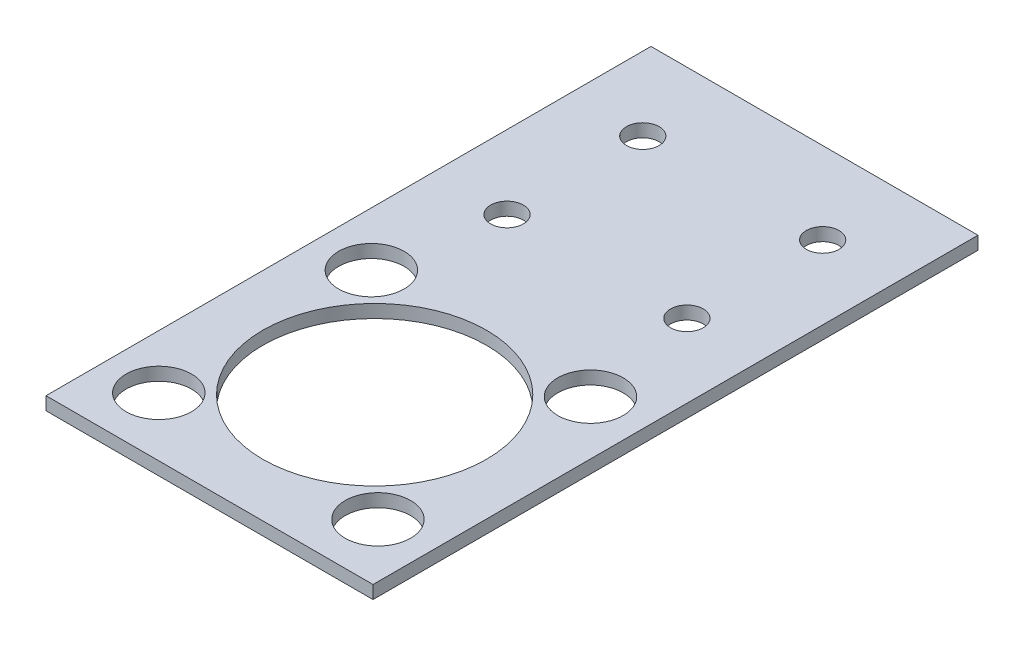
from build123d import *

# Parameters (mm, degrees)
SKETCH2_W          = 50
SKETCH2_H          = 92.5
BASE_FLANGE1_DEPTH = 2
SKETCH1_R          = 2.5
SKETCH1_R_2        = 5
SKETCH1_R_3        = 17.1
CUT_EXTRUDE1_DEPTH = 10


# Sheet-metal steps are written as plain solids
with BuildPart() as part:
    # Sketch2 → Base-Flange1 (new body)
    with BuildSketch(Plane(origin=(0, 0, 0), x_dir=(1, 0, 0), z_dir=(0, 1, 0))):
        with Locations((-2.5, -1.25)):
            Rectangle(SKETCH2_W, SKETCH2_H)
    extrude(amount=-BASE_FLANGE1_DEPTH)

    # Sketch1 → Cut-Extrude1 (cut)
    with BuildSketch(Plane(origin=(0, 0, 0), x_dir=(1, 0, 0), z_dir=(0, 1, 0))):
        with Locations(Location((-16.25, 11.74, 0), (0, 0, 270))):
            Circle(SKETCH1_R)
        with Locations(Location((11.25, 11.74, 0), (0, 0, 270))):
            Circle(SKETCH1_R)
        with Locations(Location((11.25, 32.5, 0), (0, 0, 270))):
            Circle(SKETCH1_R)
        with Locations(Location((-19.25, -38.5, 0), (0, 0, 270))):
            Circle(SKETCH1_R_2)
        with Locations(Location((14.25, -38.5, 0), (0, 0, 270))):
            Circle(SKETCH1_R_2)
        with Locations(Location((14.25, -6, 0), (0, 0, 270))):
            Circle(SKETCH1_R_2)
        with Locations(Location((-19.25, -6, 0), (0, 0, 270))):
            Circle(SKETCH1_R_2)
        with Locations(Location((-16.25, 32.5, 0), (0, 0, 270))):
            Circle(SKETCH1_R)
        with Locations(Location((-2.5, -22.25, 0), (0, 0, 270))):
            Circle(SKETCH1_R_3)
    extrude(amount=-CUT_EXTRUDE1_DEPTH, mode=Mode.SUBTRACT)


solid = part.part
